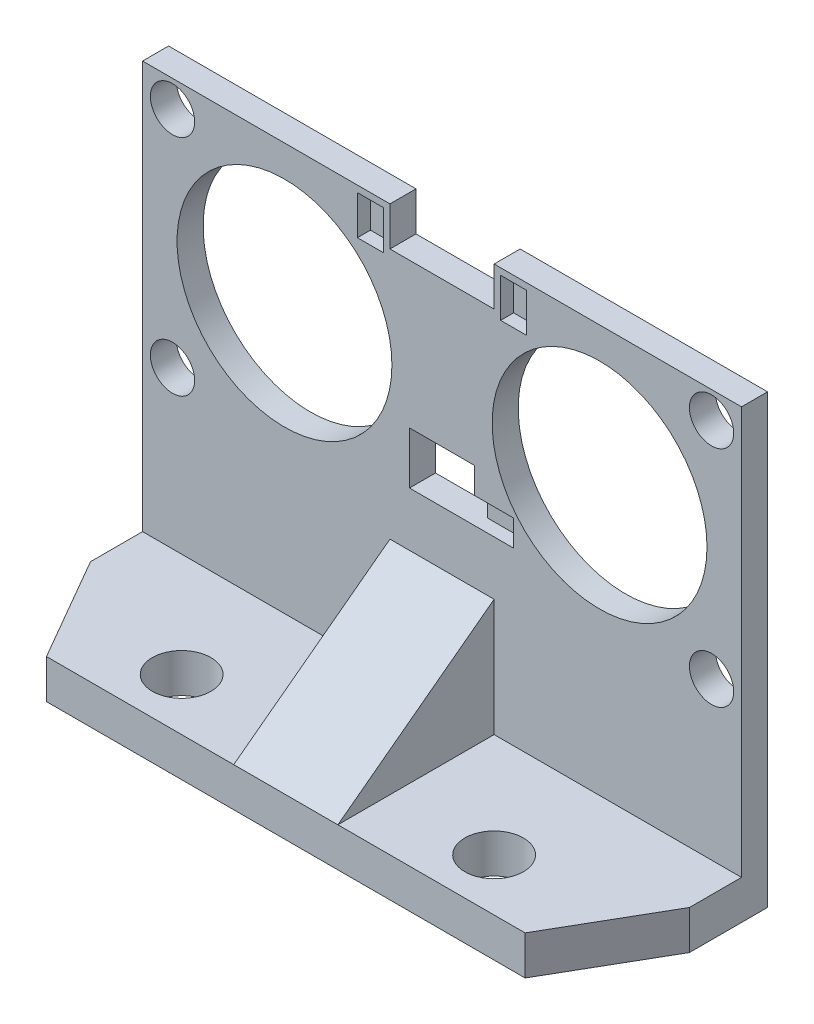
from build123d import *
from OCP.BRepFilletAPI import BRepFilletAPI_MakeChamfer

# Parameters (mm, degrees)
SKETCH_1_W          = 46
SKETCH_1_H          = 21.3
EXTRUDE_1_DEPTH     = 2
SKETCH_2_R          = 8.25
CUT_EXTRUDE_1_DEPTH = 26.424840216
SKETCH_3_W          = 8
SKETCH_3_H          = 3
CUT_EXTRUDE_2_DEPTH = 26.424840216
SKETCH_4_W          = 5
SKETCH_4_H          = 4
CUT_EXTRUDE_3_DEPTH = 26.424840216
SKETCH_5_W          = 3
SKETCH_5_H          = 2
SKETCH_5_W_2        = 2
SKETCH_5_H_2        = 3
CUT_EXTRUDE_4_DEPTH = 1
SKETCH_8_W          = 46
SKETCH_8_H          = 2
EXTRUDE_2_DEPTH     = 10
SKETCH_9_W          = 46
SKETCH_9_H          = 14
EXTRUDE_3_DEPTH     = 3
HOLE_WIZARD_M3_1_D  = 3.4
HOLE_WIZARD_M4_1_D  = 4.5
RIB_1_REACH         = 37.837
SKETCH_13_WALL_W    = 88.674891
SKETCH_13_WALL_H    = 8
CHAMFER_1_SIZE      = 8
CHAMFER_1_SIZE2     = 4.618802154


with BuildPart() as part:
    # 草圖1 → 填料-伸長1 (new body)
    with BuildSketch(Plane.XY):
        Rectangle(SKETCH_1_W, SKETCH_1_H)
    extrude(amount=EXTRUDE_1_DEPTH)

    # 草圖2 → 除料-伸長1 (cut, through all)
    with BuildSketch(Plane.XY.offset(2)):
        with Locations((-12.1, 0)):
            Circle(SKETCH_2_R)
        with Locations((12.1, 0)):
            Circle(SKETCH_2_R)
    extrude(amount=-CUT_EXTRUDE_1_DEPTH, mode=Mode.SUBTRACT)

    # 草圖3 → 除料-伸長2 (cut, through all)
    with BuildSketch(Plane.XY.offset(2)):
        with Locations((0, 9.15)):
            Rectangle(SKETCH_3_W, SKETCH_3_H)
    extrude(amount=-CUT_EXTRUDE_2_DEPTH, mode=Mode.SUBTRACT)

    # 草圖4 → 除料-伸長3 (cut, through all)
    with BuildSketch(Plane.XY.offset(2)):
        with Locations((0, -5.5)):
            Rectangle(SKETCH_4_W, SKETCH_4_H)
    extrude(amount=-CUT_EXTRUDE_3_DEPTH, mode=Mode.SUBTRACT)

    # 草圖5 → 除料-伸長4 (cut)
    with BuildSketch(Plane.XY.offset(2)):
        with Locations((4, -6.5)):
            Rectangle(SKETCH_5_W, SKETCH_5_H)
        with Locations((-5.5, 8.65)):
            Rectangle(SKETCH_5_W_2, SKETCH_5_H_2)
        with Locations((5.5, 8.65)):
            Rectangle(SKETCH_5_W_2, SKETCH_5_H_2)
    extrude(amount=-CUT_EXTRUDE_4_DEPTH, mode=Mode.SUBTRACT)

    # 草圖8 → 填料-伸長2 (add)
    with BuildSketch(Plane.XZ.offset(10.65)):
        with Locations((0, 1)):
            Rectangle(SKETCH_8_W, SKETCH_8_H)
    extrude(amount=EXTRUDE_2_DEPTH)

    # 草圖9 → 填料-伸長3 (add)
    with BuildSketch(Plane.XZ.offset(20.65)):
        with Locations((0, 7)):
            Rectangle(SKETCH_9_W, SKETCH_9_H)
    extrude(amount=EXTRUDE_3_DEPTH)

    # M3 餘隙孔1 (through all)
    with Locations(Plane.XY.offset(2)):
        with Locations((20.7, 8.6), (-20.7, -8.6), (-20.7, 8.6), (20.7, -8.6)):
            Hole(HOLE_WIZARD_M3_1_D / 2)

    # M4 餘隙孔1 (through all)
    with Locations(Plane(origin=(0, -20.65, 0), x_dir=(1, 0, 0), z_dir=(0, 1, 0))):
        with Locations((12, -10), (-12, -10)):
            Hole(HOLE_WIZARD_M4_1_D / 2)

    # 草圖13 wall → 肋材1 (add, up to next)
    with BuildSketch(Plane(origin=(0, -16.15, 8), x_dir=(0, -0.6, 0.8), z_dir=(0, -0.8, -0.6)), mode=Mode.PRIVATE) as rib_1_sk1:
        Rectangle(SKETCH_13_WALL_W, SKETCH_13_WALL_H)
    rib_1_tool1 = extrude(rib_1_sk1.sketch, amount=RIB_1_REACH, mode=Mode.PRIVATE) - part.part
    add(rib_1_tool1.solids().sort_by_distance((0, -16.15, 8))[0])

    # 導角1: one chamfer whose edges measure the first distance from different faces: ONE call of the kernel's chamfer builder (chamfer() names one face for all edges)
    chamfer_1_edges_1 = [part.edges().sort_by_distance(p)[0] for p in [
        (-23, -22.15, 14),
    ]]
    chamfer_1_side_1 = [part.faces().sort_by_distance(p)[0] for p in [
        (-23, 10.279528679, 1),
    ]]
    chamfer_1_edges_2 = [part.edges().sort_by_distance(p)[0] for p in [
        (23, -22.15, 14),
    ]]
    chamfer_1_side_2 = [part.faces().sort_by_distance(p)[0] for p in [
        (23, 10.279528679, 1),
    ]]
    chamfer_1 = BRepFilletAPI_MakeChamfer(part.part.solid().wrapped)
    for e in chamfer_1_edges_1:
        chamfer_1.Add(CHAMFER_1_SIZE, CHAMFER_1_SIZE2, e.wrapped, chamfer_1_side_1[0].wrapped)  # the first distance lies on this face
    for e in chamfer_1_edges_2:
        chamfer_1.Add(CHAMFER_1_SIZE, CHAMFER_1_SIZE2, e.wrapped, chamfer_1_side_2[0].wrapped)  # the first distance lies on this face
    add(Compound.cast(chamfer_1.Shape()), mode=Mode.REPLACE)


solid = part.part
